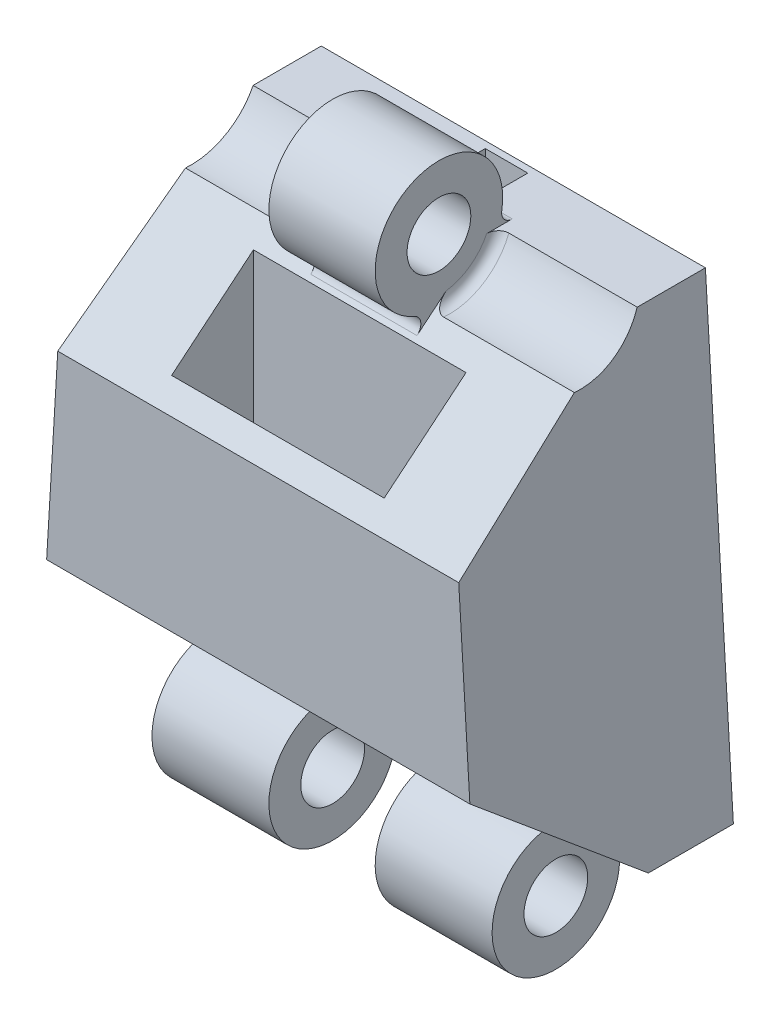
from build123d import *

# Parameters (mm, degrees)
BOSS_EXTRUDE1_DEPTH            = 12
CUT_EXTRUDE1_DEPTH             = 28.113370808
CUT_EXTRUDE1_DEPTH_BACK        = 28.113370808
SKETCH6_R                      = 3
SKETCH6_R_2                    = 1.5
BOSS_EXTRUDE2_DEPTH            = 8
SKETCH6_3_R                    = 3
SKETCH6_3_R_2                  = 1.5
CUT_EXTRUDE2_DEPTH             = 2.5
CUT_EXTRUDE3_DEPTH             = 28.113370808
CUT_EXTRUDE3_DEPTH_BACK        = 28.113370808
SKETCH9_R                      = 3
SKETCH9_R_2                    = 1.5
BOSS_EXTRUDE3_DEPTH            = 2.5
CUT_EXTRUDE4_START             = 10
SKETCH11_R                     = 3
CUT_EXTRUDE4_DEPTH             = 10
SKETCH12_R                     = 3
CUT_EXTRUDE5_DEPTH             = 10
FILLET1_R                      = 0.5
FILLET2_R                      = 0.5
CUT_EXTRUDE6_REACH             = 62.032
SKETCH14_W                     = 10
SKETCH14_H                     = 3.849855631
CUT_EXTRUDE6_DIRECTION_2_REACH = 62.032
CUT_EXTRUDE7_DEPTH             = 1


with BuildPart() as part:
    # Sketch1 → Boss-Extrude1 (new body)
    with BuildSketch(Plane.XY):
        Polygon((-56.5742778, 0), (-35.873082033, 0), (-37.188679916, 22), (-55.258679916, 22), align=None)
    extrude(amount=BOSS_EXTRUDE1_DEPTH)

    # Sketch3 → Cut-Extrude1 (cut, two sides: drawn at the far end of the back side and taken through both)
    with BuildSketch(Plane(origin=(-46.223679916, 0, 0), x_dir=(0, 0, -1), z_dir=(1, 0, 0)).offset(-CUT_EXTRUDE1_DEPTH_BACK)):
        Polygon((-12, 0), (-4, 0), (-12, 6.613954944), align=None)
    extrude(amount=CUT_EXTRUDE1_DEPTH + CUT_EXTRUDE1_DEPTH_BACK, mode=Mode.SUBTRACT)

    # Sketch6 → Boss-Extrude2 (add, symmetric)
    with BuildSketch(Plane(origin=(-46.223679916, 0, 0), x_dir=(0, 0, -1), z_dir=(1, 0, 0))):
        with Locations((-6, -1.1)):
            Circle(SKETCH6_R)
        with Locations((-6, -1.1)):
            Circle(SKETCH6_R_2, mode=Mode.SUBTRACT)
    extrude(amount=BOSS_EXTRUDE2_DEPTH, both=True)

    # Sketch6<3> → Cut-Extrude2 (cut, symmetric)
    with BuildSketch(Plane(origin=(-46.223679916, 0, 0), x_dir=(0, 0, -1), z_dir=(1, 0, 0))):
        with Locations((-6, -1.1)):
            Circle(SKETCH6_3_R)
        with Locations((-6, -1.1)):
            Circle(SKETCH6_3_R_2, mode=Mode.SUBTRACT)
    extrude(amount=CUT_EXTRUDE2_DEPTH, both=True, mode=Mode.SUBTRACT)

    # Sketch8 → Cut-Extrude3 (cut, two sides: drawn at the far end of the back side and taken through both)
    with BuildSketch(Plane(origin=(-46.223679916, 0, 0), x_dir=(0, 0, -1), z_dir=(1, 0, 0)).offset(-CUT_EXTRUDE3_DEPTH_BACK)):
        Polygon((-12, 15.370362001), (-4, 22), (-12, 22), align=None)
    extrude(amount=CUT_EXTRUDE3_DEPTH + CUT_EXTRUDE3_DEPTH_BACK, mode=Mode.SUBTRACT)

    # Sketch9 → Boss-Extrude3 (add, symmetric)
    with BuildSketch(Plane(origin=(-46.223679916, 0, 0), x_dir=(0, 0, -1), z_dir=(1, 0, 0))):
        with Locations((-6, 23.1)):
            Circle(SKETCH9_R)
        with Locations((-6, 23.1)):
            Circle(SKETCH9_R_2, mode=Mode.SUBTRACT)
    extrude(amount=BOSS_EXTRUDE3_DEPTH, both=True)

    # Sketch11 → Cut-Extrude4 (cut)
    with BuildSketch(Plane(origin=(-43.723679916, 0, 0), x_dir=(0, 0, -1), z_dir=(1, 0, 0)).offset(CUT_EXTRUDE4_START)):
        with Locations((-6, 23.1)):
            Circle(SKETCH11_R)
    extrude(amount=-CUT_EXTRUDE4_DEPTH, mode=Mode.SUBTRACT)

    # Sketch12 → Cut-Extrude5 (cut)
    with BuildSketch(Plane.ZY.offset(48.723679916)):
        with Locations((6, 23.1)):
            Circle(SKETCH12_R)
    extrude(amount=CUT_EXTRUDE5_DEPTH, mode=Mode.SUBTRACT)

    # Fillet1
    fillet1_edges = [part.edges().sort_by_distance(p)[0] for p in [
        (-46.223679916, 22, 3.208942853),
        (-46.223679916, 20.112838065, 6.277242812),
    ]]
    fillet(fillet1_edges, radius=FILLET1_R)

    # Fillet2
    fillet2_edges = [part.edges().sort_by_distance(p)[0] for p in [
        (-48.723679916, 20.54464497, 4.42832552),
        (-43.723679916, 20.54464497, 4.42832552),
    ]]
    fillet(fillet2_edges, radius=FILLET2_R)

    # Cut-Extrude6: up to this plane
    cut_extrude6_end = Plane(origin=(-56.5742778, -1.96433929, 1.624006445), z_dir=(0, 0.7707129094412332, -0.6371825572162422))
    # Sketch14 → Cut-Extrude6 (cut, up to the surface)
    with BuildSketch(Plane(origin=(0, 10, 0), x_dir=(1, 0, 0), z_dir=(0, 1, 0)), mode=Mode.PRIVATE) as cut_extrude6_sk1:
        with Locations((-46.223679916, -9.151106834)):
            Rectangle(SKETCH14_W, SKETCH14_H)
    cut_extrude6_tool1 = split(extrude(cut_extrude6_sk1.sketch, amount=-CUT_EXTRUDE6_REACH, mode=Mode.PRIVATE), bisect_by=cut_extrude6_end, keep=Keep.BOTH, mode=Mode.PRIVATE)
    add(cut_extrude6_tool1.solids().sort_by_distance((-46.22368, 10, 9.151107))[0], mode=Mode.SUBTRACT)

    # Cut-Extrude6 direction 2: up to this plane
    cut_extrude6_direction_2_end = Plane(origin=(-56.5742778, 15.008030561, 12.437226213), z_dir=(0, 0.769971126082772, 0.6380787294674757))
    # Sketch14 → Cut-Extrude6 direction 2 (cut, up to the surface)
    with BuildSketch(Plane(origin=(0, 10, 0), x_dir=(1, 0, 0), z_dir=(0, 1, 0)), mode=Mode.PRIVATE) as cut_extrude6_direction_2_sk1:
        with Locations((-46.223679916, -9.151106834)):
            Rectangle(SKETCH14_W, SKETCH14_H)
    cut_extrude6_direction_2_tool1 = split(extrude(cut_extrude6_direction_2_sk1.sketch, amount=CUT_EXTRUDE6_DIRECTION_2_REACH, mode=Mode.PRIVATE), bisect_by=cut_extrude6_direction_2_end, keep=Keep.BOTH, mode=Mode.PRIVATE)
    add(cut_extrude6_direction_2_tool1.solids().sort_by_distance((-46.22368, 10, 9.151107))[0], mode=Mode.SUBTRACT)

    # Sketch15 → Cut-Extrude7 (cut, symmetric)
    with BuildSketch(Plane(origin=(-46.223679916, 0, 0), x_dir=(0, 0, -1), z_dir=(1, 0, 0))):
        Polygon((-2.32, 0), (-2.32, 24.910570124), (-0.32, 24.910570124), (-0.32, -0.739577641), (-2.32, -0.739577641), align=None)
    extrude(amount=CUT_EXTRUDE7_DEPTH, both=True, mode=Mode.SUBTRACT)


solid = part.part
